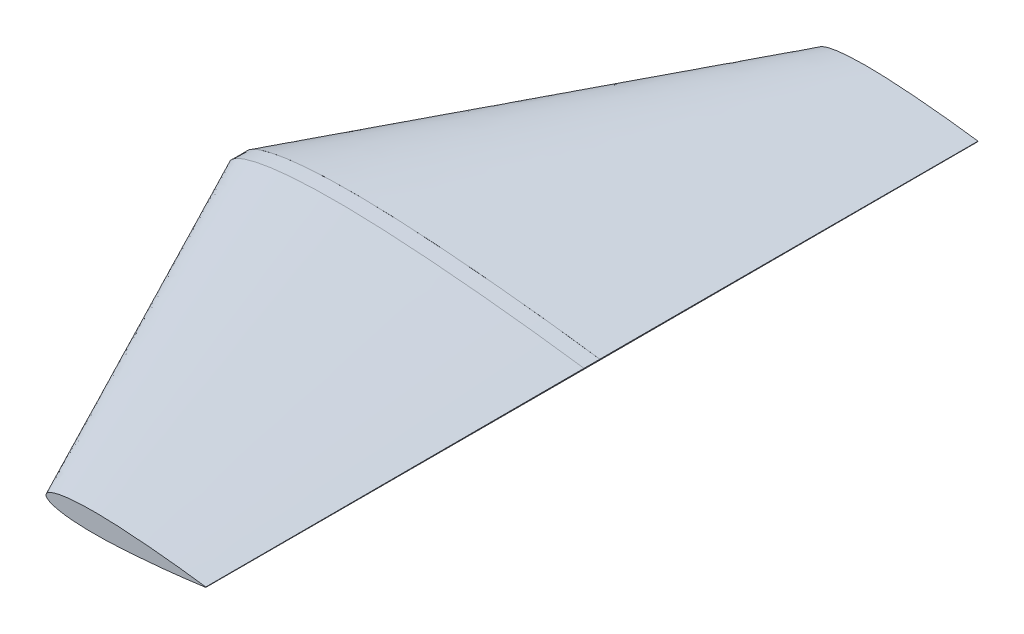
from build123d import *

# Parameters (mm, degrees)
BOSS_EXTRUDE3_DEPTH = 15.96


with BuildPart() as part:
    # Sketch2 → Loft1 section 0
    with BuildSketch(Plane.XY):
        with BuildLine():
            Line((358.4, 0.451584), (358.4, -0.451584))
            add(Edge.make_bspline(
                [(358.4, 0.451584), (358.370493197, 0.455776234), (358.25261622, 0.472523824), (357.987425173, 0.509004555), (357.545977131, 0.571487289), (356.92843457, 0.657604004), (356.135495471, 0.767829468), (355.168023696, 0.902869622), (354.02682463, 1.060540407), (352.713104427, 1.242050005), (351.228154302, 1.445894999), (349.573264695, 1.671416504), (347.75038354, 1.919164106), (345.761157156, 2.187469747), (343.607669147, 2.475885183), (341.291796969, 2.783557115), (338.816040016, 3.110485052), (336.182602929, 3.454547844), (333.39445361, 3.816352414), (330.453952291, 4.193232008), (327.364289767, 4.586634786), (324.128369503, 4.99331715), (320.749544705, 5.414152364), (317.230992263, 5.847081443), (313.576124387, 6.292432562), (309.788477158, 6.747005007), (305.872185103, 7.212301988), (301.830855109, 7.685811467), (297.668568711, 8.167514819), (293.38922822, 8.655192259), (288.997358247, 9.149618796), (284.497005463, 9.647702006), (279.892664591, 10.150096622), (275.189055561, 10.655335194), (270.390669949, 11.161881), (265.502352621, 11.669285295), (260.528816627, 12.17607287), (255.475084647, 12.682291954), (250.346003581, 13.185165124), (245.146704436, 13.684622224), (239.882325696, 14.17964794), (234.558126291, 14.66799678), (229.179344054, 15.150789423), (223.751206575, 15.624076234), (218.279088861, 16.089132995), (212.768328251, 16.543067782), (207.224477449, 16.985214929), (201.652931477, 17.414648206), (196.059259462, 17.829591647), (190.448858154, 18.229089842), (184.82751611, 18.612562018), (179.200590054, 18.976718689), (173.57373127, 19.32251746), (167.952326338, 19.647197731), (162.341912302, 19.950068951), (156.748241925, 20.230280492), (151.176632238, 20.48540269), (145.632758246, 20.715448867), (140.121946568, 20.918256983), (134.649743925, 21.094032286), (129.221583429, 21.239812606), (123.842657343, 21.356412066), (118.518423384, 21.441529077), (113.253915954, 21.494840778), (108.054506058, 21.515720335), (102.925329678, 21.502693162), (97.871402963, 21.455844982), (92.897745342, 21.374145324), (88.009252058, 21.257398429), (83.210698016, 21.105226088), (78.506871309, 20.917159067), (73.902285547, 20.693473049), (69.401758756, 20.433390164), (65.009546177, 20.137694923), (60.729980993, 19.806077267), (56.567330801, 19.439172099), (52.525706538, 19.036927669), (48.60893689, 18.60072478), (44.820984295, 18.129855784), (41.165568781, 17.625816665), (37.64650271, 17.089354071), (34.267093553, 16.520790279), (31.030519688, 15.921840642), (27.940065653, 15.292568527), (24.998721342, 14.634996665), (22.209498083, 13.949404828), (19.574908894, 13.237134604), (17.097704238, 12.499228761), (14.780136567, 11.737017641), (12.624665508, 10.951297323), (10.632884126, 10.143598615), (8.807000261, 9.314355544), (7.148452301, 8.465127734), (5.658524501, 7.597101858), (4.339363301, 6.709442992), (3.190729864, 5.804707556), (2.214667093, 4.88155169), (1.411802526, 3.940637145), (0.783218725, 2.981509091), (0.331955097, 2.003305833), (0.060122457, 1.007245603), (-0.029793506, 0), (0.060122457, -1.007245603), (0.331955097, -2.003305833), (0.783218725, -2.981509091), (1.411802526, -3.940637145), (2.214667093, -4.88155169), (3.190729864, -5.804707556), (4.339363301, -6.709442992), (5.658524501, -7.597101858), (7.148452301, -8.465127734), (8.807000261, -9.314355544), (10.632884126, -10.143598615), (12.624665508, -10.951297323), (14.780136567, -11.737017641), (17.097704238, -12.499228761), (19.574908894, -13.237134604), (22.209498083, -13.949404828), (24.998721342, -14.634996665), (27.940065653, -15.292568527), (31.030519688, -15.921840642), (34.267093553, -16.520790279), (37.64650271, -17.089354071), (41.165568781, -17.625816665), (44.820984295, -18.129855784), (48.60893689, -18.60072478), (52.525706538, -19.036927669), (56.567330801, -19.439172099), (60.729980993, -19.806077267), (65.009546177, -20.137694923), (69.401758756, -20.433390164), (73.902285547, -20.693473049), (78.506871309, -20.917159067), (83.210698016, -21.105226088), (88.009252058, -21.257398429), (92.897745342, -21.374145324), (97.871402963, -21.455844982), (102.925329678, -21.502693162), (108.054506058, -21.515720335), (113.253915954, -21.494840778), (118.518423384, -21.441529077), (123.842657343, -21.356412066), (129.221583429, -21.239812606), (134.649743925, -21.094032286), (140.121946568, -20.918256983), (145.632758246, -20.715448867), (151.176632238, -20.48540269), (156.748241925, -20.230280492), (162.341912302, -19.950068951), (167.952326338, -19.647197731), (173.57373127, -19.32251746), (179.200590054, -18.976718689), (184.82751611, -18.612562018), (190.448858154, -18.229089842), (196.059259462, -17.829591647), (201.652931477, -17.414648206), (207.224477449, -16.985214929), (212.768328251, -16.543067782), (218.279088861, -16.089132995), (223.751206575, -15.624076234), (229.179344054, -15.150789423), (234.558126291, -14.66799678), (239.882325696, -14.17964794), (245.146704436, -13.684622224), (250.346003581, -13.185165124), (255.475084647, -12.682291954), (260.528816627, -12.17607287), (265.502352621, -11.669285295), (270.390669949, -11.161881), (275.189055561, -10.655335194), (279.892664591, -10.150096622), (284.497005463, -9.647702006), (288.997358247, -9.149618796), (293.38922822, -8.655192259), (297.668568711, -8.167514819), (301.830855109, -7.685811467), (305.872185103, -7.212301988), (309.788477158, -6.747005007), (313.576124387, -6.292432562), (317.230992263, -5.847081443), (320.749544705, -5.414152364), (324.128369503, -4.99331715), (327.364289767, -4.586634786), (330.453952291, -4.193232008), (333.39445361, -3.816352414), (336.182602929, -3.454547844), (338.816040016, -3.110485052), (341.291796969, -2.783557115), (343.607669147, -2.475885183), (345.761157156, -2.187469747), (347.75038354, -1.919164106), (349.573264695, -1.671416504), (351.228154302, -1.445894999), (352.713104427, -1.242050005), (354.02682463, -1.060540407), (355.168023696, -0.902869622), (356.135495471, -0.767829468), (356.92843457, -0.657604004), (357.545977131, -0.571487289), (357.987425173, -0.509004555), (358.25261622, -0.472523824), (358.370493197, -0.455776234), (358.4, -0.451584)],
                knots=[0, 0, 0, 0, 0.000122335, 0.000488716, 0.001098794, 0.001952433, 0.003048109, 0.004384918, 0.005962173, 0.007776958, 0.009828655, 0.012114703, 0.014632672, 0.017379939, 0.020353942, 0.023551153, 0.026969568, 0.030604555, 0.034452654, 0.038510212, 0.042773347, 0.047237376, 0.05189738, 0.056749779, 0.06178911, 0.067010704, 0.072408733, 0.077977617, 0.083712875, 0.089607958, 0.095656982, 0.101854329, 0.108193623, 0.114668876, 0.121272581, 0.127999292, 0.134842052, 0.141793466, 0.148847459, 0.155996644, 0.163233587, 0.170551791, 0.177942942, 0.185400953, 0.19291752, 0.200485638, 0.208097903, 0.215745944, 0.223423313, 0.231121652, 0.238833588, 0.246551173, 0.254267122, 0.261974037, 0.269664106, 0.277330018, 0.284963452, 0.292558135, 0.300105811, 0.307599257, 0.315031719, 0.322395053, 0.329683552, 0.336889104, 0.344005588, 0.351025923, 0.357943069, 0.364751482, 0.371444179, 0.378014701, 0.384458096, 0.390767471, 0.396937472, 0.402962243, 0.408836982, 0.414556418, 0.420114835, 0.425508488, 0.43073282, 0.435782704, 0.440654597, 0.445344094, 0.449848747, 0.454164877, 0.458289244, 0.462219481, 0.465953817, 0.469490764, 0.472828095, 0.475966669, 0.478906195, 0.481648399, 0.484195581, 0.486551514, 0.488722246, 0.490716991, 0.492546624, 0.494228036, 0.495782873, 0.497239121, 0.498631855, 0.5, 0.501368145, 0.502760879, 0.504217127, 0.505771964, 0.507453376, 0.509283009, 0.511277754, 0.513448486, 0.515804419, 0.518351601, 0.521093805, 0.524033331, 0.527171905, 0.530509236, 0.534046183, 0.537780519, 0.541710756, 0.545835123, 0.550151253, 0.554655906, 0.559345403, 0.564217296, 0.56926718, 0.574491512, 0.579885165, 0.585443582, 0.591163018, 0.597037757, 0.603062528, 0.609232529, 0.615541904, 0.621985299, 0.628555821, 0.635248518, 0.642056931, 0.648974077, 0.655994412, 0.663110896, 0.670316448, 0.677604947, 0.684968281, 0.692400743, 0.699894189, 0.707441865, 0.715036548, 0.722669982, 0.730335894, 0.738025963, 0.745732878, 0.753448827, 0.761166412, 0.768878348, 0.776576687, 0.784254056, 0.791902097, 0.799514362, 0.80708248, 0.814599047, 0.822057058, 0.829448209, 0.836766413, 0.844003356, 0.851152541, 0.858206534, 0.865157948, 0.872000708, 0.878727419, 0.885331124, 0.891806377, 0.898145671, 0.904343018, 0.910392042, 0.916287125, 0.922022383, 0.927591267, 0.932989296, 0.93821089, 0.943250221, 0.94810262, 0.952762624, 0.957226653, 0.961489788, 0.965547346, 0.969395445, 0.973030432, 0.976448847, 0.979646058, 0.982620061, 0.985367328, 0.987885297, 0.990171345, 0.992223042, 0.994037827, 0.995615082, 0.996951891, 0.998047567, 0.998901206, 0.999511284, 0.999877665, 1, 1, 1, 1], degree=3))
        make_face()
    # Sketch4 → Loft1 section 1
    with BuildSketch(Plane.XY.offset(382.02)):
        with BuildLine():
            Line((358.4, 0.200512521), (358.4, -0.200512521))
            add(Edge.make_bspline(
                [(358.4, 0.200512521), (358.316495007, 0.214164345), (357.986701129, 0.268080736), (357.242971825, 0.359125252), (356.010613889, 0.534991449), (354.293929301, 0.776729913), (352.103620942, 1.060571303), (349.457936913, 1.416337084), (346.369273418, 1.811476505), (342.855226196, 2.2687684), (338.93692737, 2.740463846), (334.644021829, 3.26679869), (330.002293951, 3.80675473), (325.035256029, 4.352718291), (319.77939252, 4.926107632), (314.262289979, 5.498496217), (308.519776981, 6.051721977), (302.586284346, 6.622019873), (296.496129661, 7.143829523), (290.294446421, 7.659692897), (284.015107395, 8.131165124), (277.695232141, 8.549428034), (271.375788137, 8.921645906), (265.096297175, 9.232677786), (258.893755177, 9.479109795), (252.804087248, 9.625367243), (246.86850209, 9.698343692), (241.126113296, 9.686998732), (235.607945955, 9.55119518), (230.34965134, 9.339079185), (225.381939507, 9.021252351), (220.737757232, 8.605977405), (216.440217057, 8.091839847), (212.52045282, 7.476944761), (209.001971132, 6.778117318), (205.900607549, 6.029849201), (203.250123248, 5.167491059), (201.040753308, 4.275479636), (199.286357935, 3.322926267), (198.010750778, 2.295167564), (197.184912018, 1.199257641), (196.89496997, 0), (197.184912018, -1.199257641), (198.010750778, -2.295167564), (199.286357935, -3.322926267), (201.040753308, -4.275479636), (203.250123248, -5.167491059), (205.900607549, -6.029849201), (209.001971132, -6.778117318), (212.52045282, -7.476944761), (216.440217057, -8.091839847), (220.737757232, -8.605977405), (225.381939507, -9.021252351), (230.34965134, -9.339079185), (235.607945955, -9.55119518), (241.126113296, -9.686998732), (246.86850209, -9.698343692), (252.804087248, -9.625367243), (258.893755177, -9.479109795), (265.096297175, -9.232677786), (271.375788137, -8.921645906), (277.695232141, -8.549428034), (284.015107395, -8.131165124), (290.294446421, -7.659692897), (296.496129661, -7.143829523), (302.586284346, -6.622019873), (308.519776981, -6.051721977), (314.262289979, -5.498496217), (319.77939252, -4.926107632), (325.035256029, -4.352718291), (330.002293951, -3.80675473), (334.644021829, -3.26679869), (338.93692737, -2.740463846), (342.855226196, -2.2687684), (346.369273418, -1.811476505), (349.457936913, -1.416337084), (352.103620942, -1.060571303), (354.293929301, -0.776729913), (356.010613889, -0.534991449), (357.242971825, -0.359125252), (357.986701129, -0.268080736), (358.316495007, -0.214164345), (358.4, -0.200512521)],
                knots=[0, 0, 0, 0, 0.000771236, 0.003045914, 0.006828358, 0.012118584, 0.018847999, 0.026960335, 0.036451633, 0.04723131, 0.059261604, 0.072425456, 0.086655224, 0.101856986, 0.117973806, 0.134847943, 0.15241615, 0.170560488, 0.18918197, 0.208132203, 0.227285466, 0.246579919, 0.265864872, 0.28498788, 0.303888468, 0.322445456, 0.340510685, 0.357995982, 0.374785219, 0.390822242, 0.40596281, 0.420154966, 0.433318818, 0.445408359, 0.456311077, 0.466011684, 0.474469595, 0.481693781, 0.487709005, 0.492596045, 0.496534018, 0.5, 0.503465982, 0.507403955, 0.512290995, 0.518306219, 0.525530405, 0.533988316, 0.543688923, 0.554591641, 0.566681182, 0.579845034, 0.59403719, 0.609177758, 0.625214781, 0.642004018, 0.659489315, 0.677554544, 0.696111532, 0.71501212, 0.734135128, 0.753420081, 0.772714534, 0.791867797, 0.81081803, 0.829439512, 0.84758385, 0.865152057, 0.882026194, 0.898143014, 0.913344776, 0.927574544, 0.940738396, 0.95276869, 0.963548367, 0.973039665, 0.981152001, 0.987881416, 0.993171642, 0.996954086, 0.999228764, 1, 1, 1, 1], degree=3))
        make_face()
    loft()


with BuildPart() as body_2:
    # Sketch2<2> → Boss-Extrude3 (new body)
    with BuildSketch(Plane.XY):
        with BuildLine():
            Line((358.4, 0.451584), (358.4, -0.451584))
            add(Edge.make_bspline(
                [(358.4, 0.451584), (358.370493197, 0.455776234), (358.25261622, 0.472523824), (357.987425173, 0.509004555), (357.545977131, 0.571487289), (356.92843457, 0.657604004), (356.135495471, 0.767829468), (355.168023696, 0.902869622), (354.02682463, 1.060540407), (352.713104427, 1.242050005), (351.228154302, 1.445894999), (349.573264695, 1.671416504), (347.75038354, 1.919164106), (345.761157156, 2.187469747), (343.607669147, 2.475885183), (341.291796969, 2.783557115), (338.816040016, 3.110485052), (336.182602929, 3.454547844), (333.39445361, 3.816352414), (330.453952291, 4.193232008), (327.364289767, 4.586634786), (324.128369503, 4.99331715), (320.749544705, 5.414152364), (317.230992263, 5.847081443), (313.576124387, 6.292432562), (309.788477158, 6.747005007), (305.872185103, 7.212301988), (301.830855109, 7.685811467), (297.668568711, 8.167514819), (293.38922822, 8.655192259), (288.997358247, 9.149618796), (284.497005463, 9.647702006), (279.892664591, 10.150096622), (275.189055561, 10.655335194), (270.390669949, 11.161881), (265.502352621, 11.669285295), (260.528816627, 12.17607287), (255.475084647, 12.682291954), (250.346003581, 13.185165124), (245.146704436, 13.684622224), (239.882325696, 14.17964794), (234.558126291, 14.66799678), (229.179344054, 15.150789423), (223.751206575, 15.624076234), (218.279088861, 16.089132995), (212.768328251, 16.543067782), (207.224477449, 16.985214929), (201.652931477, 17.414648206), (196.059259462, 17.829591647), (190.448858154, 18.229089842), (184.82751611, 18.612562018), (179.200590054, 18.976718689), (173.57373127, 19.32251746), (167.952326338, 19.647197731), (162.341912302, 19.950068951), (156.748241925, 20.230280492), (151.176632238, 20.48540269), (145.632758246, 20.715448867), (140.121946568, 20.918256983), (134.649743925, 21.094032286), (129.221583429, 21.239812606), (123.842657343, 21.356412066), (118.518423384, 21.441529077), (113.253915954, 21.494840778), (108.054506058, 21.515720335), (102.925329678, 21.502693162), (97.871402963, 21.455844982), (92.897745342, 21.374145324), (88.009252058, 21.257398429), (83.210698016, 21.105226088), (78.506871309, 20.917159067), (73.902285547, 20.693473049), (69.401758756, 20.433390164), (65.009546177, 20.137694923), (60.729980993, 19.806077267), (56.567330801, 19.439172099), (52.525706538, 19.036927669), (48.60893689, 18.60072478), (44.820984295, 18.129855784), (41.165568781, 17.625816665), (37.64650271, 17.089354071), (34.267093553, 16.520790279), (31.030519688, 15.921840642), (27.940065653, 15.292568527), (24.998721342, 14.634996665), (22.209498083, 13.949404828), (19.574908894, 13.237134604), (17.097704238, 12.499228761), (14.780136567, 11.737017641), (12.624665508, 10.951297323), (10.632884126, 10.143598615), (8.807000261, 9.314355544), (7.148452301, 8.465127734), (5.658524501, 7.597101858), (4.339363301, 6.709442992), (3.190729864, 5.804707556), (2.214667093, 4.88155169), (1.411802526, 3.940637145), (0.783218725, 2.981509091), (0.331955097, 2.003305833), (0.060122457, 1.007245603), (-0.029793506, 0), (0.060122457, -1.007245603), (0.331955097, -2.003305833), (0.783218725, -2.981509091), (1.411802526, -3.940637145), (2.214667093, -4.88155169), (3.190729864, -5.804707556), (4.339363301, -6.709442992), (5.658524501, -7.597101858), (7.148452301, -8.465127734), (8.807000261, -9.314355544), (10.632884126, -10.143598615), (12.624665508, -10.951297323), (14.780136567, -11.737017641), (17.097704238, -12.499228761), (19.574908894, -13.237134604), (22.209498083, -13.949404828), (24.998721342, -14.634996665), (27.940065653, -15.292568527), (31.030519688, -15.921840642), (34.267093553, -16.520790279), (37.64650271, -17.089354071), (41.165568781, -17.625816665), (44.820984295, -18.129855784), (48.60893689, -18.60072478), (52.525706538, -19.036927669), (56.567330801, -19.439172099), (60.729980993, -19.806077267), (65.009546177, -20.137694923), (69.401758756, -20.433390164), (73.902285547, -20.693473049), (78.506871309, -20.917159067), (83.210698016, -21.105226088), (88.009252058, -21.257398429), (92.897745342, -21.374145324), (97.871402963, -21.455844982), (102.925329678, -21.502693162), (108.054506058, -21.515720335), (113.253915954, -21.494840778), (118.518423384, -21.441529077), (123.842657343, -21.356412066), (129.221583429, -21.239812606), (134.649743925, -21.094032286), (140.121946568, -20.918256983), (145.632758246, -20.715448867), (151.176632238, -20.48540269), (156.748241925, -20.230280492), (162.341912302, -19.950068951), (167.952326338, -19.647197731), (173.57373127, -19.32251746), (179.200590054, -18.976718689), (184.82751611, -18.612562018), (190.448858154, -18.229089842), (196.059259462, -17.829591647), (201.652931477, -17.414648206), (207.224477449, -16.985214929), (212.768328251, -16.543067782), (218.279088861, -16.089132995), (223.751206575, -15.624076234), (229.179344054, -15.150789423), (234.558126291, -14.66799678), (239.882325696, -14.17964794), (245.146704436, -13.684622224), (250.346003581, -13.185165124), (255.475084647, -12.682291954), (260.528816627, -12.17607287), (265.502352621, -11.669285295), (270.390669949, -11.161881), (275.189055561, -10.655335194), (279.892664591, -10.150096622), (284.497005463, -9.647702006), (288.997358247, -9.149618796), (293.38922822, -8.655192259), (297.668568711, -8.167514819), (301.830855109, -7.685811467), (305.872185103, -7.212301988), (309.788477158, -6.747005007), (313.576124387, -6.292432562), (317.230992263, -5.847081443), (320.749544705, -5.414152364), (324.128369503, -4.99331715), (327.364289767, -4.586634786), (330.453952291, -4.193232008), (333.39445361, -3.816352414), (336.182602929, -3.454547844), (338.816040016, -3.110485052), (341.291796969, -2.783557115), (343.607669147, -2.475885183), (345.761157156, -2.187469747), (347.75038354, -1.919164106), (349.573264695, -1.671416504), (351.228154302, -1.445894999), (352.713104427, -1.242050005), (354.02682463, -1.060540407), (355.168023696, -0.902869622), (356.135495471, -0.767829468), (356.92843457, -0.657604004), (357.545977131, -0.571487289), (357.987425173, -0.509004555), (358.25261622, -0.472523824), (358.370493197, -0.455776234), (358.4, -0.451584)],
                knots=[0, 0, 0, 0, 0.000122335, 0.000488716, 0.001098794, 0.001952433, 0.003048109, 0.004384918, 0.005962173, 0.007776958, 0.009828655, 0.012114703, 0.014632672, 0.017379939, 0.020353942, 0.023551153, 0.026969568, 0.030604555, 0.034452654, 0.038510212, 0.042773347, 0.047237376, 0.05189738, 0.056749779, 0.06178911, 0.067010704, 0.072408733, 0.077977617, 0.083712875, 0.089607958, 0.095656982, 0.101854329, 0.108193623, 0.114668876, 0.121272581, 0.127999292, 0.134842052, 0.141793466, 0.148847459, 0.155996644, 0.163233587, 0.170551791, 0.177942942, 0.185400953, 0.19291752, 0.200485638, 0.208097903, 0.215745944, 0.223423313, 0.231121652, 0.238833588, 0.246551173, 0.254267122, 0.261974037, 0.269664106, 0.277330018, 0.284963452, 0.292558135, 0.300105811, 0.307599257, 0.315031719, 0.322395053, 0.329683552, 0.336889104, 0.344005588, 0.351025923, 0.357943069, 0.364751482, 0.371444179, 0.378014701, 0.384458096, 0.390767471, 0.396937472, 0.402962243, 0.408836982, 0.414556418, 0.420114835, 0.425508488, 0.43073282, 0.435782704, 0.440654597, 0.445344094, 0.449848747, 0.454164877, 0.458289244, 0.462219481, 0.465953817, 0.469490764, 0.472828095, 0.475966669, 0.478906195, 0.481648399, 0.484195581, 0.486551514, 0.488722246, 0.490716991, 0.492546624, 0.494228036, 0.495782873, 0.497239121, 0.498631855, 0.5, 0.501368145, 0.502760879, 0.504217127, 0.505771964, 0.507453376, 0.509283009, 0.511277754, 0.513448486, 0.515804419, 0.518351601, 0.521093805, 0.524033331, 0.527171905, 0.530509236, 0.534046183, 0.537780519, 0.541710756, 0.545835123, 0.550151253, 0.554655906, 0.559345403, 0.564217296, 0.56926718, 0.574491512, 0.579885165, 0.585443582, 0.591163018, 0.597037757, 0.603062528, 0.609232529, 0.615541904, 0.621985299, 0.628555821, 0.635248518, 0.642056931, 0.648974077, 0.655994412, 0.663110896, 0.670316448, 0.677604947, 0.684968281, 0.692400743, 0.699894189, 0.707441865, 0.715036548, 0.722669982, 0.730335894, 0.738025963, 0.745732878, 0.753448827, 0.761166412, 0.768878348, 0.776576687, 0.784254056, 0.791902097, 0.799514362, 0.80708248, 0.814599047, 0.822057058, 0.829448209, 0.836766413, 0.844003356, 0.851152541, 0.858206534, 0.865157948, 0.872000708, 0.878727419, 0.885331124, 0.891806377, 0.898145671, 0.904343018, 0.910392042, 0.916287125, 0.922022383, 0.927591267, 0.932989296, 0.93821089, 0.943250221, 0.94810262, 0.952762624, 0.957226653, 0.961489788, 0.965547346, 0.969395445, 0.973030432, 0.976448847, 0.979646058, 0.982620061, 0.985367328, 0.987885297, 0.990171345, 0.992223042, 0.994037827, 0.995615082, 0.996951891, 0.998047567, 0.998901206, 0.999511284, 0.999877665, 1, 1, 1, 1], degree=3))
        make_face()
    extrude(amount=-BOSS_EXTRUDE3_DEPTH)


with BuildPart() as body_3:
    # Mirror12: mirrored copy
    add(part.part.mirror(Plane.XY.offset(-7.98)))


solid = Compound([part.part, body_2.part, body_3.part])
